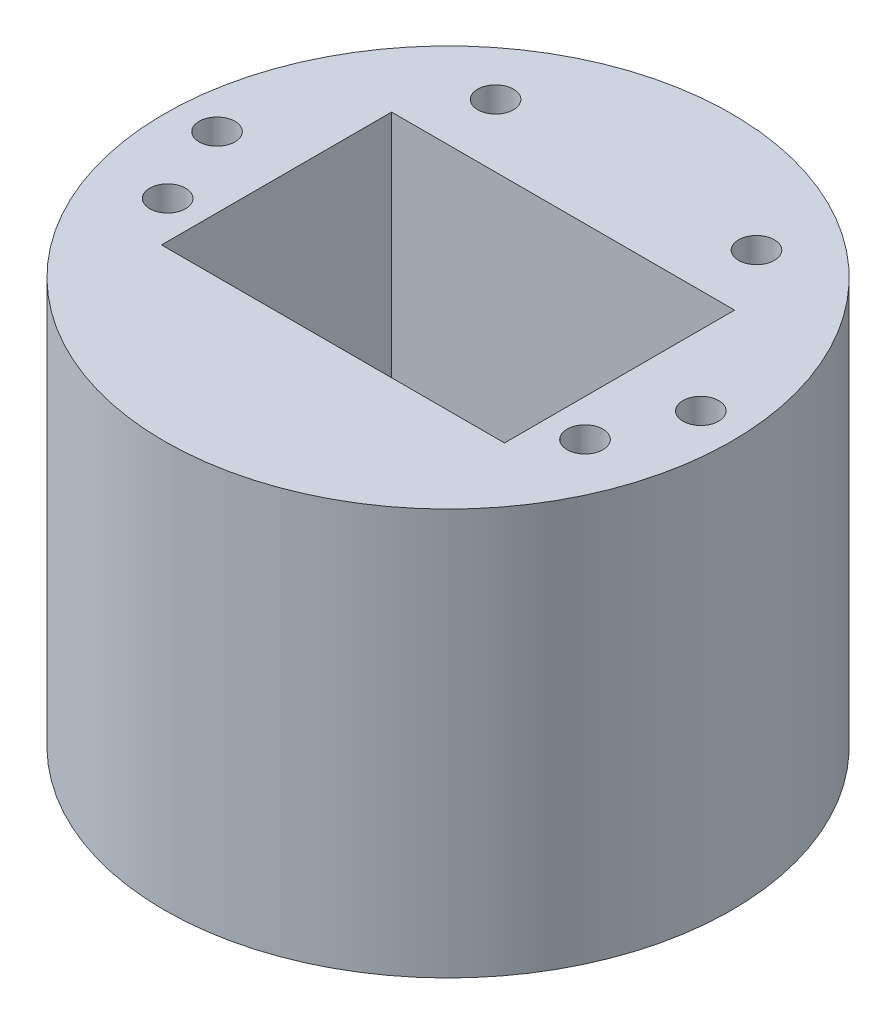
from build123d import *

# Parameters (mm, degrees)
SKETCH1_R           = 50.292
SKETCH1_R_2         = 3.175
BOSS_EXTRUDE1_DEPTH = 72
SKETCH2_W           = 60.822109288
SKETCH2_H           = 40.800022246
CUT_EXTRUDE1_DEPTH  = 68.04


with BuildPart() as part:
    # Sketch1 → Boss-Extrude1 (new body)
    with BuildSketch(Plane(origin=(0, 0, 0), x_dir=(1, 0, 0), z_dir=(0, 1, 0))):
        Circle(SKETCH1_R)
        with Locations((-37.000474826, -12.718618748)):
            Circle(SKETCH1_R_2, mode=Mode.SUBTRACT)
        with Locations((37.000474826, -12.718618748)):
            Circle(SKETCH1_R_2, mode=Mode.SUBTRACT)
        with Locations((-42.886820356, 1.924977859)):
            Circle(SKETCH1_R_2, mode=Mode.SUBTRACT)
        with Locations((-23.129730363, 31.556520301)):
            Circle(SKETCH1_R_2, mode=Mode.SUBTRACT)
        with Locations((42.886820356, 1.924977859)):
            Circle(SKETCH1_R_2, mode=Mode.SUBTRACT)
        with Locations((23.129730363, 31.556520301)):
            Circle(SKETCH1_R_2, mode=Mode.SUBTRACT)
    extrude(amount=BOSS_EXTRUDE1_DEPTH)

    # Sketch2 → Cut-Extrude1 (cut)
    with BuildSketch(Plane(origin=(0, 72, 0), x_dir=(1, 0, 0), z_dir=(0, 1, 0))):
        Rectangle(SKETCH2_W, SKETCH2_H)
    extrude(amount=-CUT_EXTRUDE1_DEPTH, mode=Mode.SUBTRACT)


solid = part.part
